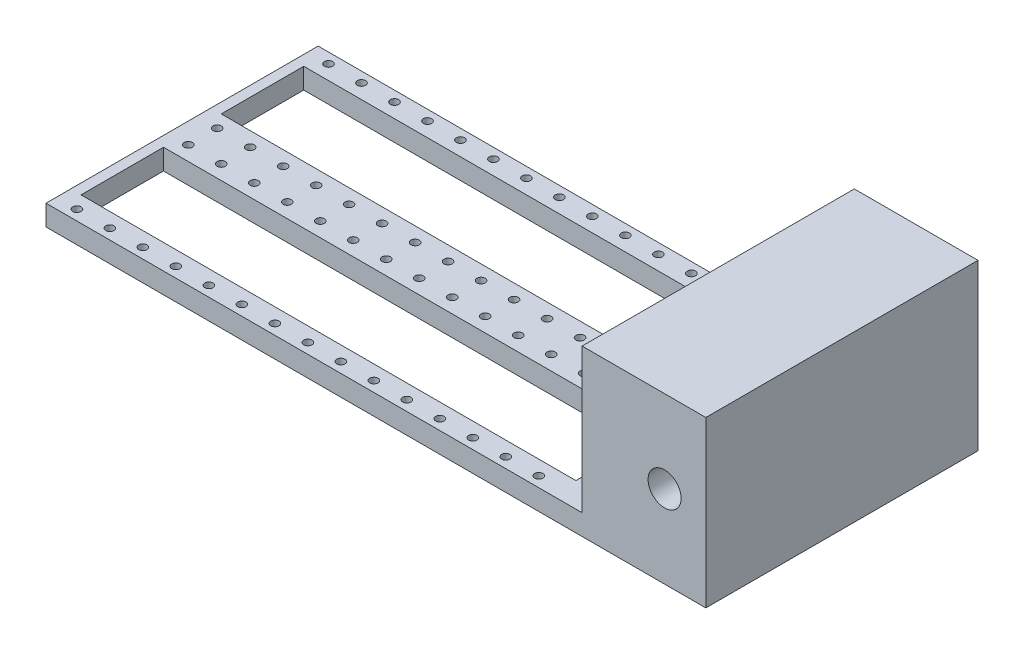
from build123d import *

# Parameters (mm, degrees)
SKETCH1_W           = 160
SKETCH1_H           = 66
BOSS_EXTRUDE1_DEPTH = 40
SKETCH2_R           = 4
SKETCH2_W           = 130
SKETCH2_H           = 35
CUT_EXTRUDE1_DEPTH  = 112.157545853
SKETCH3_R           = 1
SKETCH3_W           = 120
SKETCH3_H           = 20
CUT_EXTRUDE2_DEPTH  = 96.336247042


with BuildPart() as part:
    # Sketch1 → Boss-Extrude1 (new body)
    with BuildSketch(Plane(origin=(0, 0, 0), x_dir=(1, 0, 0), z_dir=(0, 1, 0))):
        Rectangle(SKETCH1_W, SKETCH1_H)
    extrude(amount=BOSS_EXTRUDE1_DEPTH)

    # Sketch2 → Cut-Extrude1 (cut, through all)
    with BuildSketch(Plane.XY.offset(33)):
        with Locations((70, 20)):
            Circle(SKETCH2_R)
        with Locations((-15, 22.5)):
            Rectangle(SKETCH2_W, SKETCH2_H)
    extrude(amount=-CUT_EXTRUDE1_DEPTH, mode=Mode.SUBTRACT)

    # Sketch3 → Cut-Extrude2 (cut, through all)
    with BuildSketch(Plane(origin=(0, 40, 0), x_dir=(1, 0, 0), z_dir=(0, 1, 0))):
        with Locations((-75, 30.5)):
            Circle(SKETCH3_R)
        with Locations((-75, 3.5)):
            Circle(SKETCH3_R)
        with Locations((-67, 30.5)):
            Circle(SKETCH3_R)
        with Locations((-59, 30.5)):
            Circle(SKETCH3_R)
        with Locations((-51, 30.5)):
            Circle(SKETCH3_R)
        with Locations((-43, 30.5)):
            Circle(SKETCH3_R)
        with Locations((-35, 30.5)):
            Circle(SKETCH3_R)
        with Locations((-27, 30.5)):
            Circle(SKETCH3_R)
        with Locations((-19, 30.5)):
            Circle(SKETCH3_R)
        with Locations((-11, 30.5)):
            Circle(SKETCH3_R)
        with Locations((-3, 30.5)):
            Circle(SKETCH3_R)
        with Locations((-67, 3.5)):
            Circle(SKETCH3_R)
        with Locations((-59, 3.5)):
            Circle(SKETCH3_R)
        with Locations((-51, 3.5)):
            Circle(SKETCH3_R)
        with Locations((-43, 3.5)):
            Circle(SKETCH3_R)
        with Locations((-35, 3.5)):
            Circle(SKETCH3_R)
        with Locations((-27, 3.5)):
            Circle(SKETCH3_R)
        with Locations((-19, 3.5)):
            Circle(SKETCH3_R)
        with Locations((-11, 3.5)):
            Circle(SKETCH3_R)
        with Locations((-3, 3.5)):
            Circle(SKETCH3_R)
        with Locations((5, 30.5)):
            Circle(SKETCH3_R)
        with Locations((13, 30.5)):
            Circle(SKETCH3_R)
        with Locations((21, 30.5)):
            Circle(SKETCH3_R)
        with Locations((29, 30.5)):
            Circle(SKETCH3_R)
        with Locations((37, 30.5)):
            Circle(SKETCH3_R)
        with Locations((5, 3.5)):
            Circle(SKETCH3_R)
        with Locations((13, 3.5)):
            Circle(SKETCH3_R)
        with Locations((21, 3.5)):
            Circle(SKETCH3_R)
        with Locations((29, 3.5)):
            Circle(SKETCH3_R)
        with Locations((37, 3.5)):
            Circle(SKETCH3_R)
        with Locations((37, -3.5)):
            Circle(SKETCH3_R)
        with Locations((29, -3.5)):
            Circle(SKETCH3_R)
        with Locations((21, -3.5)):
            Circle(SKETCH3_R)
        with Locations((13, -3.5)):
            Circle(SKETCH3_R)
        with Locations((5, -3.5)):
            Circle(SKETCH3_R)
        with Locations((37, -30.5)):
            Circle(SKETCH3_R)
        with Locations((29, -30.5)):
            Circle(SKETCH3_R)
        with Locations((21, -30.5)):
            Circle(SKETCH3_R)
        with Locations((13, -30.5)):
            Circle(SKETCH3_R)
        with Locations((5, -30.5)):
            Circle(SKETCH3_R)
        with Locations((-3, -3.5)):
            Circle(SKETCH3_R)
        with Locations((-11, -3.5)):
            Circle(SKETCH3_R)
        with Locations((-19, -3.5)):
            Circle(SKETCH3_R)
        with Locations((-27, -3.5)):
            Circle(SKETCH3_R)
        with Locations((-35, -3.5)):
            Circle(SKETCH3_R)
        with Locations((-43, -3.5)):
            Circle(SKETCH3_R)
        with Locations((-51, -3.5)):
            Circle(SKETCH3_R)
        with Locations((-59, -3.5)):
            Circle(SKETCH3_R)
        with Locations((-67, -3.5)):
            Circle(SKETCH3_R)
        with Locations((-3, -30.5)):
            Circle(SKETCH3_R)
        with Locations((-11, -30.5)):
            Circle(SKETCH3_R)
        with Locations((-19, -30.5)):
            Circle(SKETCH3_R)
        with Locations((-27, -30.5)):
            Circle(SKETCH3_R)
        with Locations((-35, -30.5)):
            Circle(SKETCH3_R)
        with Locations((-43, -30.5)):
            Circle(SKETCH3_R)
        with Locations((-51, -30.5)):
            Circle(SKETCH3_R)
        with Locations((-59, -30.5)):
            Circle(SKETCH3_R)
        with Locations((-67, -30.5)):
            Circle(SKETCH3_R)
        with Locations((-75, -3.5)):
            Circle(SKETCH3_R)
        with Locations((-75, -30.5)):
            Circle(SKETCH3_R)
        with Locations((-17.5, 17)):
            Rectangle(SKETCH3_W, SKETCH3_H)
        with Locations((-17.5, -17)):
            Rectangle(SKETCH3_W, SKETCH3_H)
    extrude(amount=-CUT_EXTRUDE2_DEPTH, mode=Mode.SUBTRACT)


solid = part.part
